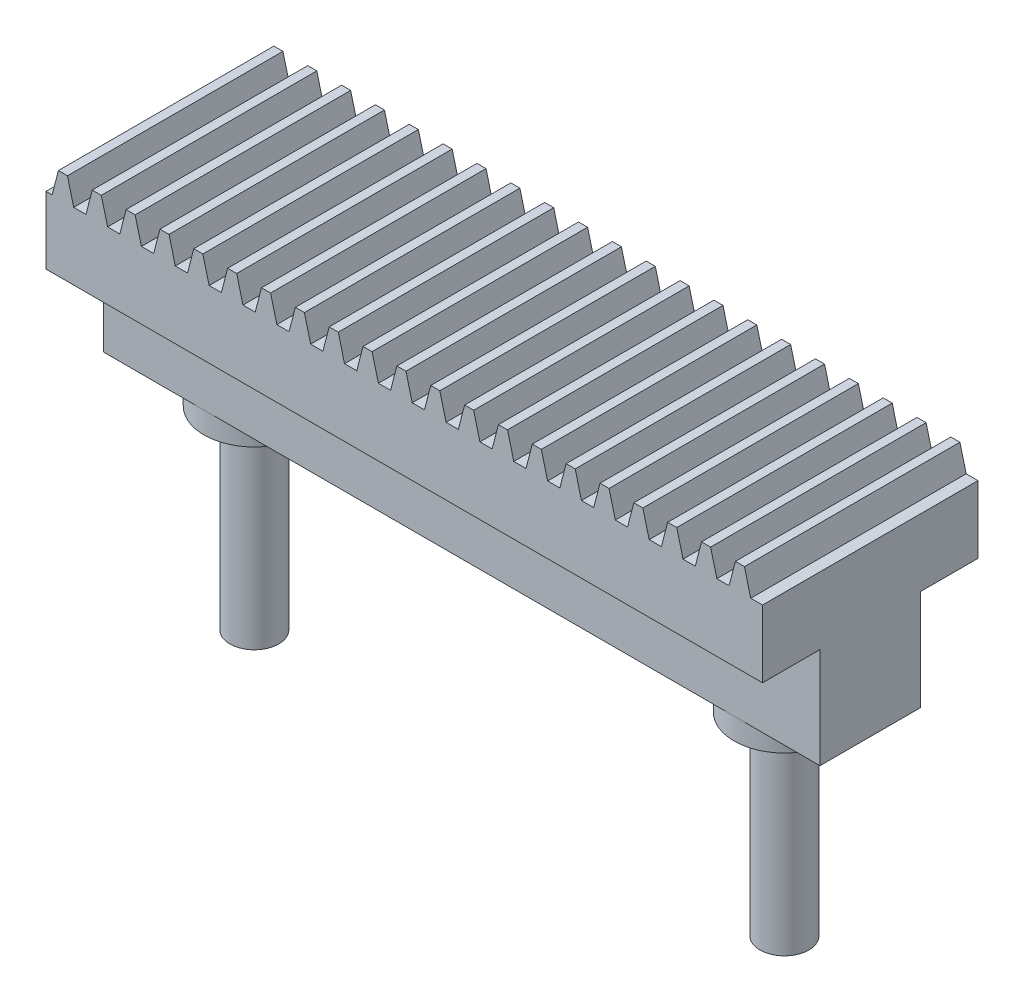
from build123d import *

# Parameters (mm, degrees)
BLANKSKE_W                 = 100
BLANKSKE_H                 = 12.75
BLANK_DEPTH                = 20
TOOTHCUTSIM_DEPTH          = 103.77432802
TEETHCUTS_COUNT            = 23
TEETHCUTS_PITCH            = 4.712388975
SALIENTE_EXTRUIR1_DEPTH    = 10
CORTAR_EXTRUIR1_DEPTH      = 103.77432802
CORTAR_EXTRUIR1_DEPTH_BACK = 0.25
CROQUIS12_W                = 30
CROQUIS12_H                = 10.100558753
CROQUIS13_W                = 99.75
CROQUIS13_H                = 14
SALIENTE_EXTRUIR6_DEPTH    = 14
CROQUIS14_R                = 7
CROQUIS14_R_2              = 3.4
SALIENTE_EXTRUIR7_DEPTH    = 3
CROQUIS15_R                = 3.4
SALIENTE_EXTRUIR8_DEPTH    = 30


with BuildPart() as part:
    # BlankSke → Blank (new body)
    with BuildSketch(Plane.XY):
        with Locations((50, 6.375)):
            Rectangle(BLANKSKE_W, BLANKSKE_H)
    extrude(amount=-BLANK_DEPTH)

    # TooCutSkeSim → ToothCutSim (cut, through all)
    with BuildSketch(Plane.XY):
        Polygon((0.852189273, 9.375), (-0.852189273, 9.375), (-1.731592507, 12.7754), (1.731592507, 12.7754), align=None)
    toothcutsim = extrude(amount=-TOOTHCUTSIM_DEPTH, mode=Mode.SUBTRACT)

    # TeethCuts: ToothCutSim ×23
    with Locations(*[(i * TEETHCUTS_PITCH, 0, 0) for i in range(1, TEETHCUTS_COUNT)]):
        add(toothcutsim, mode=Mode.SUBTRACT)

    # Croquis1 → Saliente-Extruir1 (add)
    with BuildSketch(Plane.XY):
        Polygon((99.812357748, 9.375), (98.107979202, 9.375), (97.235144855, 12.75), (95.97280312, 12.75), (95.099968773, 9.375), (93.395590227, 9.375), (92.52275588, 12.75), (91.260414145, 12.75), (90.387579798, 9.375), (88.683201252, 9.375), (87.810366905, 12.75), (86.54802517, 12.75), (85.675190823, 9.375), (83.970812277, 9.375), (83.09797793, 12.75), (81.835636195, 12.75), (80.962801848, 9.375), (79.258423302, 9.375), (78.385588955, 12.75), (77.12324722, 12.75), (76.250412873, 9.375), (74.546034327, 9.375), (73.67319998, 12.75), (72.410858245, 12.75), (71.538023898, 9.375), (69.833645352, 9.375), (68.960811005, 12.75), (67.69846927, 12.75), (66.825634923, 9.375), (65.121256377, 9.375), (64.24842203, 12.75), (62.986080295, 12.75), (62.113245948, 9.375), (60.408867402, 9.375), (59.536033055, 12.75), (58.27369132, 12.75), (57.400856973, 9.375), (55.696478427, 9.375), (54.82364408, 12.75), (53.561302345, 12.75), (52.688467998, 9.375), (50.984089452, 9.375), (50.111255105, 12.75), (48.84891337, 12.75), (47.976079023, 9.375), (46.271700477, 9.375), (45.39886613, 12.75), (44.136524395, 12.75), (43.263690048, 9.375), (41.559311502, 9.375), (40.686477155, 12.75), (39.42413542, 12.75), (38.551301073, 9.375), (36.846922527, 9.375), (35.97408818, 12.75), (34.711746445, 12.75), (33.838912098, 9.375), (32.134533552, 9.375), (31.261699205, 12.75), (29.99935747, 12.75), (29.126523123, 9.375), (27.422144577, 9.375), (26.54931023, 12.75), (25.286968495, 12.75), (24.414134148, 9.375), (22.709755602, 9.375), (21.836921255, 12.75), (20.57457952, 12.75), (19.701745173, 9.375), (17.997366627, 9.375), (17.12453228, 12.75), (15.862190545, 12.75), (14.989356198, 9.375), (13.284977652, 9.375), (12.412143305, 12.75), (11.14980157, 12.75), (10.276967223, 9.375), (8.572588677, 9.375), (7.69975433, 12.75), (6.437412595, 12.75), (5.564578248, 9.375), (3.860199702, 9.375), (2.987365355, 12.75), (1.72502362, 12.75), (0.852189273, 9.375), (0, 9.375), (0, 0), (100, 0), (100, 10.100558753), align=None)
    extrude(amount=SALIENTE_EXTRUIR1_DEPTH)

    # Croquis12 → Cortar-Extruir1 (cut, two sides: drawn at the far end of the back side and taken through both)
    with BuildSketch(Plane(origin=(100, 0, 0), x_dir=(0, 0, -1), z_dir=(1, 0, 0)).offset(-CORTAR_EXTRUIR1_DEPTH_BACK)):
        with Locations((5, 5.050279377)):
            Rectangle(CROQUIS12_W, CROQUIS12_H)
    extrude(amount=CORTAR_EXTRUIR1_DEPTH + CORTAR_EXTRUIR1_DEPTH_BACK, mode=Mode.SUBTRACT)

    # Croquis13 → Saliente-Extruir6 (add)
    with BuildSketch(Plane.XZ):
        with Locations((49.875, -5)):
            Rectangle(CROQUIS13_W, CROQUIS13_H)
    extrude(amount=SALIENTE_EXTRUIR6_DEPTH)

    # Croquis14 → Saliente-Extruir7 (add)
    # profile 1 of 2: a face of its own
    with BuildSketch(Plane.XZ.offset(14)):
        with Locations((14, -5)):
            Circle(CROQUIS14_R)
        with Locations((14, -5)):
            Circle(CROQUIS14_R_2, mode=Mode.SUBTRACT)
    # profile 2 of 2: a face of its own
    with BuildSketch(Plane.XZ.offset(14)):
        with Locations((87.8, -5)):
            Circle(CROQUIS14_R)
        with Locations((87.8, -5)):
            Circle(CROQUIS14_R_2, mode=Mode.SUBTRACT)
    extrude(amount=SALIENTE_EXTRUIR7_DEPTH)

    # Croquis15 → Saliente-Extruir8 (add)
    with BuildSketch(Plane.XZ.offset(14)):
        with Locations((87.8, -5)):
            Circle(CROQUIS15_R)
        with Locations((14, -5)):
            Circle(CROQUIS15_R)
    extrude(amount=SALIENTE_EXTRUIR8_DEPTH)


solid = part.part
